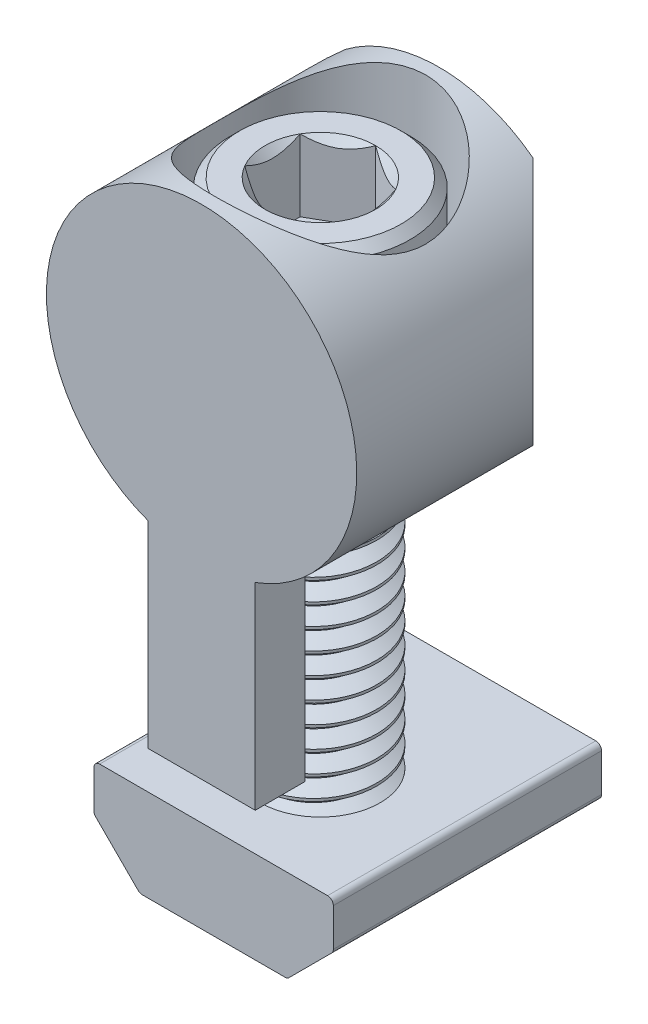
from build123d import *

# Parameters (mm, degrees)
SKETCH1_R               = 3.96875
BOSS_EXTRUDE1_DEPTH     = 33.02
CUT_SWEEP1_PITCH        = 1.411111111
SKETCH4_OUTSIDE_W       = 19.736
SKETCH4_OUTSIDE_H       = 19.736
SKETCH4_OUTSIDE_R       = 2.899449189
CUT_EXTRUDE1_DEPTH      = 1.411111111
CUT_EXTRUDE1_DRAFT      = -45
SKETCH5_R               = 5.953125
BOSS_EXTRUDE2_DEPTH     = 7.9375
CUT_EXTRUDE2_DEPTH      = 4.7625
CHAMFER1_SIZE           = 0.5953125
SKETCH8_R               = 10.287
BOSS_EXTRUDE3_DEPTH     = 7.874
BOSS_EXTRUDE4_DEPTH     = 3.302
CUT_EXTRUDE4_DEPTH      = 36.470306618
CUT_EXTRUDE4_DEPTH_BACK = 36.470306618
SKETCH11_R              = 6.985
CUT_EXTRUDE5_DEPTH      = 36.470306618
SKETCH12_R              = 4.064
CUT_EXTRUDE6_DEPTH      = 36.47030667
BOSS_EXTRUDE5_START     = -0.8001
BOSS_EXTRUDE5_DEPTH     = 17.78
SKETCH14_R              = 3.96875
CUT_EXTRUDE7_DEPTH      = 40.239401624
FILLET1_R               = 0.381


with BuildPart() as part:
    # Sketch1 → Boss-Extrude1 (new body)
    with BuildSketch(Plane(origin=(0, 0, 0), x_dir=(1, 0, 0), z_dir=(0, 1, 0))):
        with Locations(Location((0, 0, 0), (0, 0, 270))):
            Circle(SKETCH1_R)
    extrude(amount=-BOSS_EXTRUDE1_DEPTH)

    # Cut-Sweep1: the profile of Sketch3 screwed along a right-hand helix of 24.4 turns, 8 arcs to a turn; built about Z, then put on its axis
    cut_sweep1_z = Axis((0, 0, 0), (0, 0, 1))
    cut_sweep1_corners = [(3.052206448, 0, -0.529166667), (4.045128629, 0, 0.044097222), (4.045128629, 0, -1.278819444), (3.052206448, 0, -0.705555556)]
    with BuildLine(mode=Mode.PRIVATE) as cut_sweep1_profile:
        Line(cut_sweep1_corners[0], cut_sweep1_corners[1])
        Line(cut_sweep1_corners[1], cut_sweep1_corners[2])
        Line(cut_sweep1_corners[2], cut_sweep1_corners[3])
        Line(cut_sweep1_corners[3], cut_sweep1_corners[0])
    cut_sweep1_cap = Face(cut_sweep1_profile.wire())
    cut_sweep1_turn_angles = [0, 22.5, 45, 67.5, 90, 112.5, 135, 157.5, 180, 202.5, 225, 247.5, 270, 292.5, 315, 337.5, 360]
    cut_sweep1_turn_weights = [1, 0.9238795325112867, 1, 0.9238795325112867, 1, 0.9238795325112867, 1, 0.9238795325112867, 1, 0.9238795325112867, 1, 0.9238795325112867, 1, 0.9238795325112867, 1, 0.9238795325112867, 1]
    cut_sweep1_turn_rails = [Edge.make_bspline([Vector(p[0], p[1], 0).rotate(cut_sweep1_z, cut_sweep1_turn_angles[k]) / cut_sweep1_turn_weights[k] + Vector(0, 0, p[2] + CUT_SWEEP1_PITCH * cut_sweep1_turn_angles[k] / 360) for k in range(17)], [0, 0, 0, 1, 1, 2, 2, 3, 3, 4, 4, 5, 5, 6, 6, 7, 7, 8, 8, 8], 2, cut_sweep1_turn_weights) for p in cut_sweep1_corners]
    cut_sweep1_turn_sides = [Face.make_surface_from_curves(cut_sweep1_turn_rails[p[0]], cut_sweep1_turn_rails[p[1]]) for p in [(0, 1), (1, 2), (2, 3), (3, 0)]]
    cut_sweep1_last_angles = [8640, 8662.5, 8685, 8707.5, 8730, 8752.5, 8775, 8779.5, 8784]
    cut_sweep1_last_weights = [1, 0.9238795325112867, 1, 0.9238795325112867, 1, 0.9238795325112867, 1, 0.9969173337331504, 1]
    cut_sweep1_last_rails = [Edge.make_bspline([Vector(p[0], p[1], 0).rotate(cut_sweep1_z, cut_sweep1_last_angles[k]) / cut_sweep1_last_weights[k] + Vector(0, 0, p[2] + CUT_SWEEP1_PITCH * cut_sweep1_last_angles[k] / 360) for k in range(9)], [0, 0, 0, 1, 1, 2, 2, 3, 3, 4, 4, 4], 2, cut_sweep1_last_weights) for p in cut_sweep1_corners]
    cut_sweep1_last_sides = [Face.make_surface_from_curves(cut_sweep1_last_rails[p[0]], cut_sweep1_last_rails[p[1]]) for p in [(0, 1), (1, 2), (2, 3), (3, 0)]]
    cut_sweep1 = Plane(origin=(0, -33.02, 0), x_dir=(0, 0, -1), z_dir=(0, 1, 0)) * Solid(Shell([*[p.moved(Location((0, 0, CUT_SWEEP1_PITCH * i))) for i in range(24) for p in cut_sweep1_turn_sides], *cut_sweep1_last_sides, cut_sweep1_cap, cut_sweep1_cap.rotate(cut_sweep1_z, 8784).moved(Location((0, 0, CUT_SWEEP1_PITCH * 8784 / 360)))]))
    add(cut_sweep1, mode=Mode.SUBTRACT)


with BuildPart() as cut_extrude1_tool:
    # Sketch4 outside → Cut-Extrude1 (with draft: the straight prism first)
    with BuildSketch(Plane.XZ.offset(33.02)):
        Rectangle(SKETCH4_OUTSIDE_W, SKETCH4_OUTSIDE_H)
        Circle(SKETCH4_OUTSIDE_R, mode=Mode.SUBTRACT)
    extrude(amount=-CUT_EXTRUDE1_DEPTH)
    # Cut-Extrude1: the draft: its side faces are tilted about the plane it starts from
    cut_extrude1_sides = [cut_extrude1_tool.faces().sort_by_distance(p)[0] for p in [
        (0, -32.314444444, -9.868),
        (9.868, -32.314444444, 0),
        (0, -32.314444444, 9.868),
        (-9.868, -32.314444444, 0),
        (-2.899449189, -32.314444444, 0),
    ]]
    draft(cut_extrude1_sides, Plane.XZ.offset(33.02), CUT_EXTRUDE1_DRAFT)


with BuildPart() as part_1:
    add(part.part)

    # Cut-Extrude1: cut by cut_extrude1_tool
    add(cut_extrude1_tool.part, mode=Mode.SUBTRACT)

    # Sketch5 → Boss-Extrude2 (add)
    with BuildSketch(Plane(origin=(0, 0, 0), x_dir=(1, 0, 0), z_dir=(0, 1, 0))):
        with Locations(Location((0, 0, 0), (0, 0, 270))):
            Circle(SKETCH5_R)
    extrude(amount=BOSS_EXTRUDE2_DEPTH)

    # Sketch6 → Cut-Extrude2 (cut)
    with BuildSketch(Plane(origin=(0, 7.9375, 0), x_dir=(1, 0, 0), z_dir=(0, 1, 0))):
        Polygon((0, 3.666174209), (-3.175, 1.833087105), (-3.175, -1.833087105), (0, -3.666174209), (3.175, -1.833087105), (3.175, 1.833087105), align=None)
    extrude(amount=-CUT_EXTRUDE2_DEPTH, mode=Mode.SUBTRACT)

    # Cut-Extrude3 cone 1 section (through the dimple's axis) → Cut-Extrude3 (revolve, cut)
    with BuildSketch(Plane(origin=(0, 7.9375, 0), x_dir=(0, 0, 1), z_dir=(1, 0, 0))):
        Polygon((0, 0), (3.666174209, 0), (0, 3.666174209), align=None)
    revolve(axis=Axis((0, 7.9375, 0), (0, -1, 0)), mode=Mode.SUBTRACT)

    # Chamfer1
    chamfer1_edges = [part_1.edges().sort_by_distance(p)[0] for p in [
        (0, 7.9375, -5.953125),
    ]]
    chamfer(chamfer1_edges, length=CHAMFER1_SIZE)


with BuildPart() as body_2:
    # Sketch8 → Boss-Extrude3 (new, symmetric)
    with BuildSketch(Plane.XY):
        with Locations((0, 0.0508)):
            Circle(SKETCH8_R)
    extrude(amount=BOSS_EXTRUDE3_DEPTH, both=True)

    # Sketch9 → Boss-Extrude4 (add)
    with BuildSketch(Plane.XY.offset(7.874)):
        with BuildLine():
            Line((-3.558267134, -9.6012), (-3.558267134, -22.6822))
            Line((-3.558267134, -22.6822), (3.558267134, -22.6822))
            Line((3.558267134, -22.6822), (3.558267134, -9.6012))
            ThreePointArc((3.558267134, -9.6012), (0, -10.2362), (-3.558267134, -9.6012))
        make_face()
    extrude(amount=-BOSS_EXTRUDE4_DEPTH)

    # Sketch10 → Cut-Extrude4 (cut, two sides: drawn at the far end of the back side and taken through both)
    with BuildSketch(Plane(origin=(0, 0, 0), x_dir=(1, 0, 0), z_dir=(0, 1, 0)).offset(-CUT_EXTRUDE4_DEPTH_BACK)):
        Polygon((-10.287, 7.874), (-10.287, 3.81), (-6.223, 7.874), align=None)
        Polygon((10.287, 7.874), (6.223, 7.874), (10.287, 3.81), align=None)
    extrude(amount=CUT_EXTRUDE4_DEPTH + CUT_EXTRUDE4_DEPTH_BACK, mode=Mode.SUBTRACT)

    # Sketch11 → Cut-Extrude5 (cut, through all)
    with BuildSketch(Plane(origin=(0, 0, 0), x_dir=(1, 0, 0), z_dir=(0, 1, 0))):
        with Locations(Location((0, 0, 0), (0, 0, 90))):
            Circle(SKETCH11_R)
    extrude(amount=CUT_EXTRUDE5_DEPTH, mode=Mode.SUBTRACT)

    # Sketch12 → Cut-Extrude6 (cut, through all)
    with BuildSketch(Plane(origin=(0, 0, 0), x_dir=(1, 0, 0), z_dir=(0, 1, 0))):
        with Locations(Location((0, 0, 0), (0, 0, 270))):
            Circle(SKETCH12_R)
    extrude(amount=-CUT_EXTRUDE6_DEPTH, mode=Mode.SUBTRACT)


with BuildPart() as body_3:
    # Sketch13 → Boss-Extrude5 (new body)
    with BuildSketch(Plane.XY.offset(7.874).offset(BOSS_EXTRUDE5_START)):
        Polygon((-7.9375, -29.0322), (-7.9375, -25.9842), (7.9375, -25.9842), (7.9375, -29.0322), (4.8895, -32.0802), (-4.8895, -32.0802), align=None)
    extrude(amount=-BOSS_EXTRUDE5_DEPTH)

    # Sketch14 → Cut-Extrude7 (cut, through all)
    with BuildSketch(Plane(origin=(0, -25.9842, 0), x_dir=(1, 0, 0), z_dir=(0, 1, 0))):
        with Locations(Location((0, 0, 0), (0, 0, 270))):
            Circle(SKETCH14_R)
    extrude(amount=-CUT_EXTRUDE7_DEPTH, mode=Mode.SUBTRACT)

    # Fillet1
    fillet1_edges = [body_3.edges().sort_by_distance(p)[0] for p in [
        (-7.9375, -29.0322, -1.8161),
        (-7.9375, -25.9842, -1.8161),
        (7.9375, -25.9842, -1.8161),
        (7.9375, -29.0322, -1.8161),
        (4.8895, -32.0802, -1.8161),
        (-4.8895, -32.0802, -1.8161),
    ]]
    fillet(fillet1_edges, radius=FILLET1_R)


solid = Compound([part_1.part, body_2.part, body_3.part])
